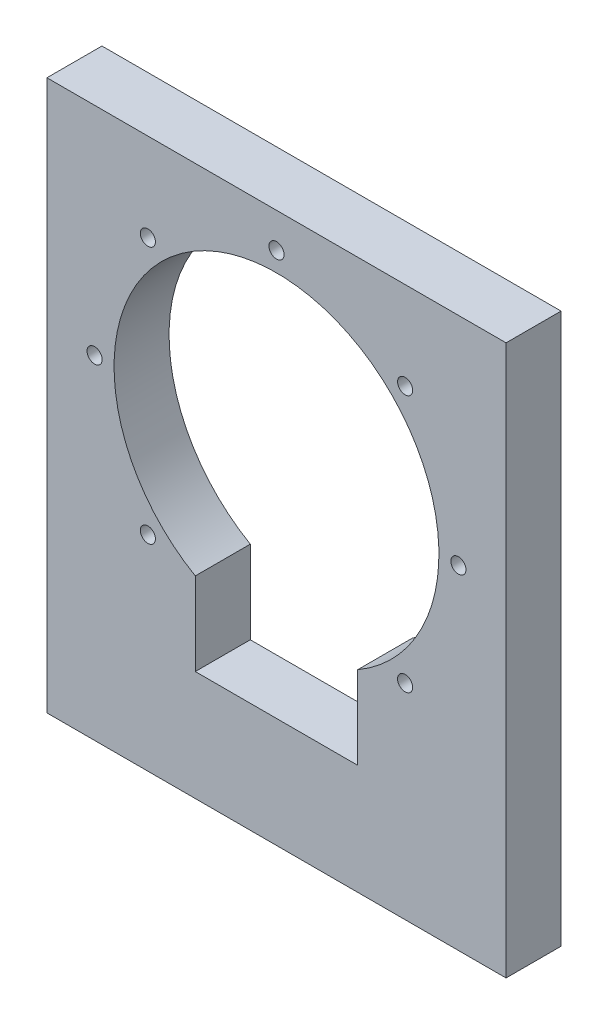
from build123d import *

# Parameters (mm, degrees)
SKETCH1_W           = 106
SKETCH1_H           = 127
SKETCH1_R           = 1.746
BOSS_EXTRUDE1_DEPTH = 12.7


with BuildPart() as part:
    # Sketch1 → Boss-Extrude1 (new body)
    with BuildSketch(Plane.XY):
        with Locations((53, 12.7)):
            Rectangle(SKETCH1_W, SKETCH1_H)
        with Locations((82.698486542, 55.898482492)):
            Circle(SKETCH1_R, mode=Mode.SUBTRACT)
        with Locations((95.00000245, 26.19999595)):
            Circle(SKETCH1_R, mode=Mode.SUBTRACT)
        with Locations((82.698486542, -3.498490592)):
            Circle(SKETCH1_R, mode=Mode.SUBTRACT)
        with Locations((23.301513458, -3.498490592)):
            Circle(SKETCH1_R, mode=Mode.SUBTRACT)
        with Locations((10.99999755, 26.1999984)):
            Circle(SKETCH1_R, mode=Mode.SUBTRACT)
        with Locations((23.301513458, 55.898482492)):
            Circle(SKETCH1_R, mode=Mode.SUBTRACT)
        with Locations((53, 68.1999984)):
            Circle(SKETCH1_R, mode=Mode.SUBTRACT)
        with BuildLine():
            Line((34.25, -6.275954242), (34.25, -25.4))
            Line((34.25, -25.4), (71.75, -25.4))
            Line((71.75, -25.4), (71.75, -6.275954242))
            ThreePointArc((71.75, -6.275954242), (53, 63.6999984), (34.25, -6.275954242))
        make_face(mode=Mode.SUBTRACT)
    extrude(amount=BOSS_EXTRUDE1_DEPTH)


solid = part.part
